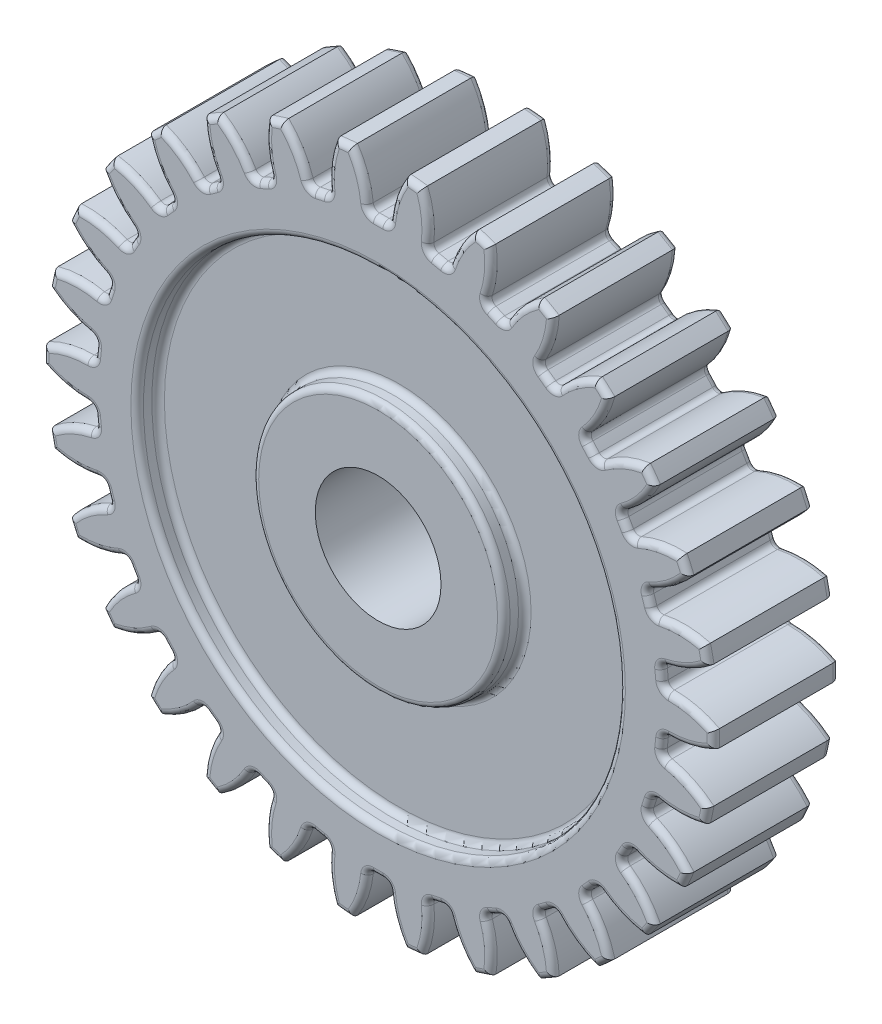
from build123d import *

# Parameters (mm, degrees)
SKBASE_R                                      = 16
BASE_DEPTH                                    = 7.5
TOOTHPROFILE_DEPTH                            = 24.837994882
FILLETTOOTHPROFILE_R                          = 0.3
CIRPATTERNTEETH_COUNT                         = 30
FILLETTOOTHPROFILE_OF_CIRPATTERNTEETH_R       = 0.3
SKCHAVETA_R                                   = 5
SKCHAVETA_W                                   = 3
SKCHAVETA_H                                   = 3
CHAVETA_DEPTH                                 = 28.117759464
SKREBAIXO_R                                   = 12.5
SKREBAIXO_R_2                                 = 7.5
REBAIXO_DEPTH                                 = 3
FILLETACABAMENTO_R                            = 0.2
BALANCEAMENTO_DEPTH                           = 26.580713003
CHAMFERBALANCEAMENTO_SIZE                     = 0.5
CHAMFERBALANCEAMENTO_OF_MIRRORBALANCEAME_SIZE = 0.5
BOSS_EXTRUDE1_DEPTH                           = 9
BOSS_EXTRUDE2_DEPTH                           = 15
SKETCH6_R                                     = 17.05207789
CUT_EXTRUDE1_DEPTH                            = 10
SKETCH7_R                                     = 17.444412972
CUT_EXTRUDE2_DEPTH                            = 10
SKETCH8_R                                     = 11.5
SKETCH8_R_2                                   = 6
CUT_EXTRUDE3_DEPTH                            = 1
FILLET1_R                                     = 0.3
FILLET2_R                                     = 0.3
SKETCH9_R                                     = 3
CUT_EXTRUDE4_DEPTH                            = 24.374620351


with BuildPart() as part:
    # skBase → Base (new, symmetric)
    with BuildSketch(Plane.XY):
        Circle(SKBASE_R)
    extrude(amount=BASE_DEPTH, both=True)

    # skToothProfile → ToothProfile (cut, symmetric)
    with BuildSketch(Plane.XY):
        with BuildLine():
            ThreePointArc((-0.512986858, 13.590321721), (-0.959792464, 15.394598198), (-2.08884202, 16.871180724))
            ThreePointArc((-2.08884202, 16.871180724), (0, 17), (2.08884202, 16.871180724))
            ThreePointArc((2.08884202, 16.871180724), (0.959792464, 15.394598198), (0.512986858, 13.590321721))
            ThreePointArc((0.512986858, 13.590321721), (0, 13.6), (-0.512986858, 13.590321721))
        make_face()
    toothprofile = extrude(amount=TOOTHPROFILE_DEPTH, both=True, mode=Mode.SUBTRACT)

    # FilletToothProfile
    fillettoothprofile_edges = [part.edges().sort_by_distance(p)[0] for p in [
        (-0.512986858, 13.590321721, 0),
        (0.512986858, 13.590321721, 0),
    ]]
    fillet(fillettoothprofile_edges, radius=FILLETTOOTHPROFILE_R)

    # CirPatternTeeth: ToothProfile ×30 about axis
    cirpatternteeth_axis = Axis((0, 0, 0), (0, 0, 1))
    for i in range(1, CIRPATTERNTEETH_COUNT):
        add(toothprofile.rotate(cirpatternteeth_axis, i * 360 / CIRPATTERNTEETH_COUNT), mode=Mode.SUBTRACT)

    # FilletToothProfile of CirPatternTeeth
    fillettoothprofile_of_cirpatternteeth_edges = [part.edges().sort_by_distance(p)[0] for p in [
        (-3.327363632, 13.18668462, 0),
        (-2.323809904, 13.39999655, 0),
        (-5.996318649, 12.206726124, 0),
        (-5.059045021, 12.624027229, 0),
        (-8.403205767, 10.693275122, 0),
        (-7.573175596, 11.296327341, 0),
        (-10.442832471, 8.712476685, 0),
        (-9.756322056, 9.474923743, 0),
        (-12.026057285, 6.35090121, 0),
        (-11.513070427, 7.239420511, 0),
        (-13.083685688, 3.711760877, 0),
        (-12.766642374, 4.687519865, 0),
        (-13.569494245, 0.910398783, 0),
        (-13.462250789, 1.930752107, 0),
        (-13.462250789, -1.930752107, 0),
        (-13.569494245, -0.910398783, 0),
        (-12.766642374, -4.687519865, 0),
        (-13.083685688, -3.711760877, 0),
        (-11.513070427, -7.239420511, 0),
        (-12.026057285, -6.35090121, 0),
        (-9.756322056, -9.474923743, 0),
        (-10.442832471, -8.712476685, 0),
        (-7.573175596, -11.296327341, 0),
        (-8.403205767, -10.693275122, 0),
        (-5.059045021, -12.624027229, 0),
        (-5.996318649, -12.206726124, 0),
        (-2.323809904, -13.39999655, 0),
        (-3.327363632, -13.18668462, 0),
        (0.512986858, -13.590321721, 0),
        (-0.512986858, -13.590321721, 0),
        (3.327363632, -13.18668462, 0),
        (2.323809904, -13.39999655, 0),
        (5.996318649, -12.206726124, 0),
        (5.059045021, -12.624027229, 0),
        (8.403205767, -10.693275122, 0),
        (7.573175596, -11.296327341, 0),
        (10.442832471, -8.712476685, 0),
        (9.756322056, -9.474923743, 0),
        (12.026057285, -6.35090121, 0),
        (11.513070427, -7.239420511, 0),
        (13.083685688, -3.711760877, 0),
        (12.766642374, -4.687519865, 0),
        (13.569494245, -0.910398783, 0),
        (13.462250789, -1.930752107, 0),
        (13.462250789, 1.930752107, 0),
        (13.569494245, 0.910398783, 0),
        (12.766642374, 4.687519865, 0),
        (13.083685688, 3.711760877, 0),
        (11.513070427, 7.239420511, 0),
        (12.026057285, 6.35090121, 0),
        (9.756322056, 9.474923743, 0),
        (10.442832471, 8.712476685, 0),
        (7.573175596, 11.296327341, 0),
        (8.403205767, 10.693275122, 0),
        (5.059045021, 12.624027229, 0),
        (5.996318649, 12.206726124, 0),
        (2.323809904, 13.39999655, 0),
        (3.327363632, 13.18668462, 0),
    ]]
    fillet(fillettoothprofile_of_cirpatternteeth_edges, radius=FILLETTOOTHPROFILE_OF_CIRPATTERNTEETH_R)

    # skChaveta → Chaveta (cut, through all)
    with BuildSketch(Plane.XY.offset(7.5)):
        Circle(SKCHAVETA_R)
        with Locations((0, 4.5)):
            Rectangle(SKCHAVETA_W, SKCHAVETA_H)
    extrude(amount=-CHAVETA_DEPTH, mode=Mode.SUBTRACT)

    # skRebaixo → Rebaixo (cut)
    with BuildSketch(Plane.XY.offset(7.5)):
        Circle(SKREBAIXO_R)
        Circle(SKREBAIXO_R_2, mode=Mode.SUBTRACT)
    rebaixo = extrude(amount=-REBAIXO_DEPTH, mode=Mode.SUBTRACT)

    # MirrorRebaixo: Rebaixo across plane
    add(rebaixo.mirror(Plane.XY), mode=Mode.SUBTRACT)

    # FilletAcabamento
    filletacabamento_edges = [part.edges().sort_by_distance(p)[0] for p in [
        (-15.650361612, 3.326587053, 7.5),
        (-16, 0, 7.5),
        (-15.650361612, -3.326587053, 7.5),
        (-14.616727322, -6.507786289, 7.5),
        (-12.94427191, -9.404564037, 7.5),
        (-10.706089702, -11.890317208, 7.5),
        (-8, -13.856406461, 7.5),
        (-0.776016127, 14.954425429, 7.5),
        (-4.94427191, -15.216904261, 7.5),
        (-1.672455412, -15.912350326, 7.5),
        (1.672455412, -15.912350326, 7.5),
        (4.94427191, -15.216904261, 7.5),
        (8, -13.856406461, 7.5),
        (10.706089702, -11.890317208, 7.5),
        (12.94427191, -9.404564037, 7.5),
        (14.616727322, -6.507786289, 7.5),
        (15.650361612, -3.326587053, 7.5),
        (16, 0, 7.5),
        (15.650361612, 3.326587053, 7.5),
        (14.616727322, 6.507786289, 7.5),
        (12.94427191, 9.404564037, 7.5),
        (10.706089702, 11.890317208, 7.5),
        (8, 13.856406461, 7.5),
        (4.94427191, 15.216904261, 7.5),
        (1.672455412, 15.912350326, 7.5),
        (14.791387749, 2.334928138, 7.5),
        (13.982701581, 5.359206793, 7.5),
        (12.562904257, 8.149262394, 7.5),
        (10.594047734, 10.583156124, 7.5),
        (8.162180489, 12.554515148, 7.5),
        (5.37358679, 13.977181617, 7.5),
        (2.350141564, 14.788978179, 7.5),
        (-3.868258189, 14.466292529, 7.5),
        (-6.791438806, 13.345913228, 7.5),
        (-9.417800958, 11.642253478, 7.5),
        (-11.632560017, 9.429771386, 7.5),
        (-13.338920384, 6.805163035, 7.5),
        (-14.462305923, 3.883136404, 7.5),
        (-14.953619295, 0.79139808, 7.5),
        (-14.791387749, -2.334928138, 7.5),
        (-13.982701581, -5.359206793, 7.5),
        (-12.562904257, -8.149262394, 7.5),
        (-10.594047734, -10.583156124, 7.5),
        (-8.162180489, -12.554515148, 7.5),
        (-5.37358679, -13.977181617, 7.5),
        (-2.350141564, -14.788978179, 7.5),
        (0.776016127, -14.954425429, 7.5),
        (3.868258189, -14.466292529, 7.5),
        (6.791438806, -13.345913228, 7.5),
        (9.417800958, -11.642253478, 7.5),
        (11.632560017, -9.429771386, 7.5),
        (13.338920384, -6.805163035, 7.5),
        (14.462305923, -3.883136404, 7.5),
        (14.953619295, -0.79139808, 7.5),
        (0.776016127, 14.954425429, -7.5),
        (0.776016127, 14.954425429, 7.5),
        (0, 13.6, -7.5),
        (0, 13.6, 7.5),
        (0.432989425, 13.674006708, 7.5),
        (0.432989425, 13.674006708, -7.5),
        (-0.432989425, 13.674006708, 7.5),
        (-0.432989425, 13.674006708, -7.5),
        (-4.94427191, 15.216904261, -7.5),
        (-8, 13.856406461, -7.5),
        (-10.706089702, 11.890317208, -7.5),
        (-12.94427191, 9.404564037, -7.5),
        (-14.616727322, 6.507786289, -7.5),
        (-15.650361612, 3.326587053, -7.5),
        (-16, 0, -7.5),
        (-15.650361612, -3.326587053, -7.5),
        (-14.616727322, -6.507786289, -7.5),
        (-12.94427191, -9.404564037, -7.5),
        (-10.706089702, -11.890317208, -7.5),
        (-8, -13.856406461, -7.5),
        (-4.94427191, -15.216904261, -7.5),
        (-1.672455412, -15.912350326, -7.5),
        (1.672455412, -15.912350326, -7.5),
        (4.94427191, -15.216904261, -7.5),
        (8, -13.856406461, -7.5),
        (10.706089702, -11.890317208, -7.5),
        (12.94427191, -9.404564037, -7.5),
        (14.616727322, -6.507786289, -7.5),
        (15.650361612, -3.326587053, -7.5),
        (-2.350141564, 14.788978179, -7.5),
        (-2.350141564, 14.788978179, 7.5),
        (-2.827598995, 13.30280737, -7.5),
        (-2.827598995, 13.30280737, 7.5),
        (16, 0, -7.5),
        (-2.419458288, 13.465220417, 7.5),
        (-2.419458288, 13.465220417, -7.5),
        (-3.266513422, 13.285173291, 7.5),
        (-3.266513422, 13.285173291, -7.5),
        (15.650361612, 3.326587053, -7.5),
        (-5.37358679, 13.977181617, -7.5),
        (14.616727322, 6.507786289, -7.5),
        (-5.37358679, 13.977181617, 7.5),
        (-5.531618346, 12.424218224, -7.5),
        (-5.531618346, 12.424218224, 7.5),
        (-5.166164064, 12.667939381, 7.5),
        (12.94427191, 9.404564037, -7.5),
        (-5.166164064, 12.667939381, -7.5),
        (-5.957275108, 12.315714051, 7.5),
        (-5.957275108, 12.315714051, -7.5),
        (10.706089702, 11.890317208, -7.5),
        (-8.162180489, 12.554515148, -7.5),
        (-8.162180489, 12.554515148, 7.5),
        (-7.993879431, 11.002631123, -7.5),
        (-7.993879431, 11.002631123, 7.5),
        (8, 13.856406461, -7.5),
        (-7.68708368, 11.317008606, 7.5),
        (-7.68708368, 11.317008606, -7.5),
        (-8.387675286, 10.80799901, 7.5),
        (-8.387675286, 10.80799901, -7.5),
        (4.94427191, 15.216904261, -7.5),
        (-10.594047734, 10.583156124, -7.5),
        (-10.594047734, 10.583156124, 7.5),
        (-10.106769626, 9.100176246, -7.5),
        (1.672455412, 15.912350326, -7.5),
        (-10.106769626, 9.100176246, 7.5),
        (-9.872040852, 9.47147025, 7.5),
        (-9.872040852, 9.47147025, -7.5),
        (-10.451493805, 8.82792255, 7.5),
        (-10.451493805, 8.82792255, -7.5),
        (2.350141564, 14.788978179, -7.5),
        (-12.562904257, 8.149262394, -7.5),
        (-12.562904257, 8.149262394, 7.5),
        (-11.777945491, 6.8, -7.5),
        (-11.777945491, 6.8, 7.5),
        (-11.625542468, 7.211983195, 7.5),
        (-11.625542468, 7.211983195, -7.5),
        (-12.058531893, 6.462023513, 7.5),
        (-12.058531893, 6.462023513, -7.5),
        (-1.672455412, 15.912350326, -7.5),
        (5.37358679, 13.977181617, -7.5),
        (-13.982701581, 5.359206793, -7.5),
        (-13.982701581, 5.359206793, 7.5),
        (-12.934368622, 4.202631123, -7.5),
        (-12.934368622, 4.202631123, 7.5),
        (-12.870952093, 4.637297868, 7.5),
        (-12.870952093, 4.637297868, -7.5),
        (-13.138554274, 3.81370304, 7.5),
        (-13.138554274, 3.81370304, -7.5),
        (8.162180489, 12.554515148, -7.5),
        (-14.791387749, 2.334928138, -7.5),
        (-14.791387749, 2.334928138, 7.5),
        (-13.525497777, 1.4215871, -7.5),
        (-13.525497777, 1.4215871, 7.5),
        (-13.55383935, 1.859940371, 7.5),
        (-13.55383935, 1.859940371, -7.5),
        (-13.644358788, 0.998705445, 7.5),
        (-13.644358788, 0.998705445, -7.5),
        (10.594047734, 10.583156124, -7.5),
        (-14.953619295, -0.79139808, -7.5),
        (-14.953619295, -0.79139808, 7.5),
        (-13.525497777, -1.4215871, -7.5),
        (-13.525497777, -1.4215871, 7.5),
        (-13.644358788, -0.998705445, 7.5),
        (-13.644358788, -0.998705445, -7.5),
        (-13.55383935, -1.859940371, 7.5),
        (-13.55383935, -1.859940371, -7.5),
        (12.562904257, 8.149262394, -7.5),
        (-14.462305923, -3.883136404, -7.5),
        (-14.462305923, -3.883136404, 7.5),
        (-12.934368622, -4.202631123, -7.5),
        (-12.934368622, -4.202631123, 7.5),
        (-13.138554274, -3.81370304, 7.5),
        (-13.138554274, -3.81370304, -7.5),
        (-12.870952093, -4.637297868, 7.5),
        (-12.870952093, -4.637297868, -7.5),
        (13.982701581, 5.359206793, -7.5),
        (-13.338920384, -6.805163035, -7.5),
        (-13.338920384, -6.805163035, 7.5),
        (-11.777945491, -6.8, -7.5),
        (-11.777945491, -6.8, 7.5),
        (-12.058531893, -6.462023513, 7.5),
        (-12.058531893, -6.462023513, -7.5),
        (-11.625542468, -7.211983195, 7.5),
        (-11.625542468, -7.211983195, -7.5),
        (14.791387749, 2.334928138, -7.5),
        (-11.632560017, -9.429771386, -7.5),
        (-11.632560017, -9.429771386, 7.5),
        (-10.106769626, -9.100176246, -7.5),
        (-10.106769626, -9.100176246, 7.5),
        (-10.451493805, -8.82792255, 7.5),
        (-10.451493805, -8.82792255, -7.5),
        (-9.872040852, -9.47147025, 7.5),
        (-9.872040852, -9.47147025, -7.5),
        (14.953619295, -0.79139808, -7.5),
        (-9.417800958, -11.642253478, -7.5),
        (-9.417800958, -11.642253478, 7.5),
        (-7.993879431, -11.002631123, -7.5),
        (-7.993879431, -11.002631123, 7.5),
        (-8.387675286, -10.80799901, 7.5),
        (-8.387675286, -10.80799901, -7.5),
        (-7.68708368, -11.317008606, 7.5),
        (-7.68708368, -11.317008606, -7.5),
        (-0.776016127, 14.954425429, -7.5),
        (14.462305923, -3.883136404, -7.5),
        (-6.791438806, -13.345913228, -7.5),
        (-6.791438806, -13.345913228, 7.5),
        (-5.531618346, -12.424218224, -7.5),
        (-5.531618346, -12.424218224, 7.5),
        (-5.957275108, -12.315714051, 7.5),
        (-5.957275108, -12.315714051, -7.5),
        (-5.166164064, -12.667939381, 7.5),
        (-5.166164064, -12.667939381, -7.5),
        (13.338920384, -6.805163035, -7.5),
        (-3.868258189, -14.466292529, -7.5),
        (-3.868258189, -14.466292529, 7.5),
        (-2.827598995, -13.30280737, -7.5),
        (-2.827598995, -13.30280737, 7.5),
        (-3.266513422, -13.285173291, 7.5),
        (-3.266513422, -13.285173291, -7.5),
        (-2.419458288, -13.465220417, 7.5),
        (-2.419458288, -13.465220417, -7.5),
        (11.632560017, -9.429771386, -7.5),
        (-0.776016127, -14.954425429, -7.5),
        (-0.776016127, -14.954425429, 7.5),
        (0, -13.6, -7.5),
        (0, -13.6, 7.5),
        (-0.432989425, -13.674006708, 7.5),
        (-0.432989425, -13.674006708, -7.5),
        (0.432989425, -13.674006708, 7.5),
        (0.432989425, -13.674006708, -7.5),
        (9.417800958, -11.642253478, -7.5),
        (2.350141564, -14.788978179, -7.5),
        (2.350141564, -14.788978179, 7.5),
        (2.827598995, -13.30280737, -7.5),
        (2.827598995, -13.30280737, 7.5),
        (2.419458288, -13.465220417, 7.5),
        (2.419458288, -13.465220417, -7.5),
        (3.266513422, -13.285173291, 7.5),
        (3.266513422, -13.285173291, -7.5),
        (6.791438806, -13.345913228, -7.5),
        (5.37358679, -13.977181617, -7.5),
        (5.37358679, -13.977181617, 7.5),
        (5.531618346, -12.424218224, -7.5),
        (5.531618346, -12.424218224, 7.5),
        (5.166164064, -12.667939381, 7.5),
        (5.166164064, -12.667939381, -7.5),
        (5.957275108, -12.315714051, 7.5),
        (5.957275108, -12.315714051, -7.5),
        (3.868258189, -14.466292529, -7.5),
        (8.162180489, -12.554515148, -7.5),
        (8.162180489, -12.554515148, 7.5),
        (7.993879431, -11.002631123, -7.5),
        (7.993879431, -11.002631123, 7.5),
        (7.68708368, -11.317008606, 7.5),
        (7.68708368, -11.317008606, -7.5),
        (8.387675286, -10.80799901, 7.5),
        (8.387675286, -10.80799901, -7.5),
        (0.776016127, -14.954425429, -7.5),
        (-1.672455412, 15.912350326, 7.5),
        (10.594047734, -10.583156124, -7.5),
        (10.594047734, -10.583156124, 7.5),
        (10.106769626, -9.100176246, -7.5),
        (10.106769626, -9.100176246, 7.5),
        (9.872040852, -9.47147025, 7.5),
        (9.872040852, -9.47147025, -7.5),
        (10.451493805, -8.82792255, 7.5),
        (10.451493805, -8.82792255, -7.5),
        (-2.350141564, -14.788978179, -7.5),
        (12.562904257, -8.149262394, -7.5),
        (12.562904257, -8.149262394, 7.5),
        (11.777945491, -6.8, -7.5),
        (11.777945491, -6.8, 7.5),
        (11.625542468, -7.211983195, 7.5),
        (11.625542468, -7.211983195, -7.5),
        (12.058531893, -6.462023513, 7.5),
        (12.058531893, -6.462023513, -7.5),
        (-5.37358679, -13.977181617, -7.5),
        (13.982701581, -5.359206793, -7.5),
        (13.982701581, -5.359206793, 7.5),
        (12.934368622, -4.202631123, -7.5),
        (12.934368622, -4.202631123, 7.5),
        (12.870952093, -4.637297868, 7.5),
        (12.870952093, -4.637297868, -7.5),
        (13.138554274, -3.81370304, 7.5),
        (13.138554274, -3.81370304, -7.5),
        (-8.162180489, -12.554515148, -7.5),
        (14.791387749, -2.334928138, -7.5),
        (14.791387749, -2.334928138, 7.5),
        (13.525497777, -1.4215871, -7.5),
        (13.525497777, -1.4215871, 7.5),
        (13.55383935, -1.859940371, 7.5),
        (13.55383935, -1.859940371, -7.5),
        (13.644358788, -0.998705445, 7.5),
        (13.644358788, -0.998705445, -7.5),
        (-10.594047734, -10.583156124, -7.5),
        (14.953619295, 0.79139808, -7.5),
        (14.953619295, 0.79139808, 7.5),
        (13.525497777, 1.4215871, -7.5),
        (13.525497777, 1.4215871, 7.5),
        (13.644358788, 0.998705445, 7.5),
        (13.644358788, 0.998705445, -7.5),
        (13.55383935, 1.859940371, 7.5),
        (13.55383935, 1.859940371, -7.5),
        (-12.562904257, -8.149262394, -7.5),
        (14.462305923, 3.883136404, -7.5),
        (14.462305923, 3.883136404, 7.5),
        (12.934368622, 4.202631123, -7.5),
        (12.934368622, 4.202631123, 7.5),
        (13.138554274, 3.81370304, 7.5),
        (13.138554274, 3.81370304, -7.5),
        (12.870952093, 4.637297868, 7.5),
        (12.870952093, 4.637297868, -7.5),
        (-13.982701581, -5.359206793, -7.5),
        (13.338920384, 6.805163035, -7.5),
        (13.338920384, 6.805163035, 7.5),
        (11.777945491, 6.8, -7.5),
        (11.777945491, 6.8, 7.5),
        (12.058531893, 6.462023513, 7.5),
        (12.058531893, 6.462023513, -7.5),
        (11.625542468, 7.211983195, 7.5),
        (11.625542468, 7.211983195, -7.5),
        (-14.791387749, -2.334928138, -7.5),
        (11.632560017, 9.429771386, -7.5),
        (11.632560017, 9.429771386, 7.5),
        (10.106769626, 9.100176246, -7.5),
        (10.106769626, 9.100176246, 7.5),
        (10.451493805, 8.82792255, 7.5),
        (10.451493805, 8.82792255, -7.5),
        (9.872040852, 9.47147025, 7.5),
        (9.872040852, 9.47147025, -7.5),
        (-14.953619295, 0.79139808, -7.5),
        (9.417800958, 11.642253478, -7.5),
        (9.417800958, 11.642253478, 7.5),
        (7.993879431, 11.002631123, -7.5),
        (7.993879431, 11.002631123, 7.5),
        (8.387675286, 10.80799901, 7.5),
        (8.387675286, 10.80799901, -7.5),
        (7.68708368, 11.317008606, 7.5),
        (-14.462305923, 3.883136404, -7.5),
        (7.68708368, 11.317008606, -7.5),
        (6.791438806, 13.345913228, -7.5),
        (6.791438806, 13.345913228, 7.5),
        (5.531618346, 12.424218224, -7.5),
        (5.531618346, 12.424218224, 7.5),
        (5.957275108, 12.315714051, 7.5),
        (5.957275108, 12.315714051, -7.5),
        (5.166164064, 12.667939381, 7.5),
        (-13.338920384, 6.805163035, -7.5),
        (5.166164064, 12.667939381, -7.5),
        (3.868258189, 14.466292529, -7.5),
        (3.868258189, 14.466292529, 7.5),
        (2.827598995, 13.30280737, -7.5),
        (2.827598995, 13.30280737, 7.5),
        (3.266513422, 13.285173291, 7.5),
        (3.266513422, 13.285173291, -7.5),
        (2.419458288, 13.465220417, 7.5),
        (-11.632560017, 9.429771386, -7.5),
        (2.419458288, 13.465220417, -7.5),
        (-9.417800958, 11.642253478, -7.5),
        (-6.791438806, 13.345913228, -7.5),
        (-1.5, 5.384848004, -7.5),
        (0, 6, 7.5),
        (-1.5, 6, 0),
        (1.5, 5.384848004, 7.5),
        (1.5, 4.769696007, 0),
        (1.5, 6, 0),
        (-1.5, 5.384848004, 7.5),
        (0, -5, 7.5),
        (1.5, 5.384848004, -7.5),
        (0, 6, -7.5),
        (-1.5, 4.769696007, 0),
        (0, -5, -7.5),
        (-12.5, 0, 4.5),
        (-7.5, 0, 4.5),
        (-3.868258189, 14.466292529, -7.5),
        (-12.5, 0, 7.5),
        (-7.5, 0, 7.5),
        (-12.5, 0, -4.5),
        (-7.5, 0, -7.5),
        (-12.5, 0, -7.5),
        (-7.5, 0, -4.5),
        (-4.94427191, 15.216904261, 7.5),
        (-8, 13.856406461, 7.5),
        (-10.706089702, 11.890317208, 7.5),
        (-12.94427191, 9.404564037, 7.5),
        (-14.616727322, 6.507786289, 7.5),
    ]]
    fillet(filletacabamento_edges, radius=FILLETACABAMENTO_R)

    # skBalanceamento → Balanceamento (cut, through all)
    with BuildSketch(Plane(origin=(0, 0, -4.5), x_dir=(-1, 0, 0), z_dir=(0, 0, -1))):
        with BuildLine():
            ThreePointArc((9.526279442, 5.5), (0, 11), (-9.526279442, 5.5))
            ThreePointArc((-9.526279442, 5.5), (-9.160254038, 4.133974596), (-7.794228634, 4.5))
            ThreePointArc((-7.794228634, 4.5), (0, 9), (7.794228634, 4.5))
            ThreePointArc((7.794228634, 4.5), (9.160254038, 4.133974596), (9.526279442, 5.5))
        make_face()
    balanceamento = extrude(amount=-BALANCEAMENTO_DEPTH, mode=Mode.SUBTRACT)

    # ChamferBalanceamento
    chamferbalanceamento_edges = [part.edges().sort_by_distance(p)[0] for p in [
        (-9.160254038, 4.133974596, 4.5),
        (0, 9, 4.5),
        (9.160254038, 4.133974596, 4.5),
        (0, 11, 4.5),
        (-9.160254038, 4.133974596, -4.5),
        (0, 11, -4.5),
        (9.160254038, 4.133974596, -4.5),
        (0, 9, -4.5),
    ]]
    chamfer(chamferbalanceamento_edges, length=CHAMFERBALANCEAMENTO_SIZE)

    # MirrorBalanceamento: Balanceamento across plane
    add(balanceamento.mirror(Plane.ZX), mode=Mode.SUBTRACT)

    # ChamferBalanceamento of MirrorBalanceame
    chamferbalanceamento_of_mirrorbalanceame_edges = [part.edges().sort_by_distance(p)[0] for p in [
        (-9.160254038, -4.133974596, 4.5),
        (0, -9, 4.5),
        (9.160254038, -4.133974596, 4.5),
        (0, -11, 4.5),
        (-9.160254038, -4.133974596, -4.5),
        (0, -11, -4.5),
        (9.160254038, -4.133974596, -4.5),
        (0, -9, -4.5),
    ]]
    chamfer(chamferbalanceamento_of_mirrorbalanceame_edges, length=CHAMFERBALANCEAMENTO_OF_MIRRORBALANCEAME_SIZE)

    # Sketch4 → Boss-Extrude1 (add)
    with BuildSketch(Plane(origin=(0, 0, -4.5), x_dir=(-1, 0, 0), z_dir=(0, 0, -1))):
        with BuildLine():
            ThreePointArc((9.959292144, 5.75), (0, 11.5), (-9.959292144, 5.75))
            ThreePointArc((-9.959292144, 5.75), (-9.410254038, 3.700961894), (-7.361215932, 4.25))
            ThreePointArc((-7.361215932, 4.25), (0, 8.5), (7.361215932, 4.25))
            ThreePointArc((7.361215932, 4.25), (9.410254038, 3.700961894), (9.959292144, 5.75))
        make_face()
        with BuildLine():
            ThreePointArc((9.959292144, -5.75), (9.410254038, -3.700961894), (7.361215932, -4.25))
            ThreePointArc((7.361215932, -4.25), (0, -8.5), (-7.361215932, -4.25))
            ThreePointArc((-7.361215932, -4.25), (-9.410254038, -3.700961894), (-9.959292144, -5.75))
            ThreePointArc((-9.959292144, -5.75), (0, -11.5), (9.959292144, -5.75))
        make_face()
    extrude(amount=-BOSS_EXTRUDE1_DEPTH)

    # Sketch5 → Boss-Extrude2 (add)
    with BuildSketch(Plane(origin=(0, 0, -7.5), x_dir=(-1, 0, 0), z_dir=(0, 0, -1))):
        with BuildLine():
            Line((1.7, 5.8), (1.7, 4.91426495))
            ThreePointArc((1.7, 4.91426495), (0, -5.2), (-1.7, 4.91426495))
            Line((-1.7, 4.91426495), (-1.7, 5.8))
            ThreePointArc((-1.7, 5.8), (-1.582842712, 6.082842712), (-1.3, 6.2))
            Line((-1.3, 6.2), (1.3, 6.2))
            ThreePointArc((1.3, 6.2), (1.582842712, 6.082842712), (1.7, 5.8))
        make_face()
        with BuildLine():
            Line((-2, 1.5), (2, 1.5))
            ThreePointArc((2, 1.5), (2.5, 0), (2, -1.5))
            Line((2, -1.5), (-2, -1.5))
            ThreePointArc((-2, -1.5), (-2.5, 0), (-2, 1.5))
        make_face(mode=Mode.SUBTRACT)
    extrude(amount=-BOSS_EXTRUDE2_DEPTH)

    # Sketch6 → Cut-Extrude1 (cut)
    with BuildSketch(Plane.XY.offset(3)):
        Circle(SKETCH6_R)
    extrude(amount=CUT_EXTRUDE1_DEPTH, mode=Mode.SUBTRACT)

    # Sketch7 → Cut-Extrude2 (cut)
    with BuildSketch(Plane.XY.offset(-3)):
        Circle(SKETCH7_R)
    extrude(amount=-CUT_EXTRUDE2_DEPTH, mode=Mode.SUBTRACT)

    # Sketch8 → Cut-Extrude3 (cut)
    with BuildSketch(Plane(origin=(0, 0, -3), x_dir=(-1, 0, 0), z_dir=(0, 0, -1))):
        Circle(SKETCH8_R)
        Circle(SKETCH8_R_2, mode=Mode.SUBTRACT)
    cut_extrude3 = extrude(amount=-CUT_EXTRUDE3_DEPTH, mode=Mode.SUBTRACT)

    # Mirror1: Cut-Extrude3 across plane
    add(cut_extrude3.mirror(Plane.XY), mode=Mode.SUBTRACT)

    # Fillet1
    fillet1_edges = [part.edges().sort_by_distance(p)[0] for p in [
        (11.5, 0, -2),
        (6, 0, -2),
        (11.5, 0, -3),
        (6, 0, -3),
        (11.5, 0, 2),
        (6, 0, 3),
        (11.5, 0, 3),
        (6, 0, 2),
    ]]
    fillet(fillet1_edges, radius=FILLET1_R)

    # Fillet2
    fillet2_edges = [part.edges().sort_by_distance(p)[0] for p in [
        (-2.827598995, -13.30280737, 3),
        (-2.419458288, -13.465220417, 3),
        (-2.350141564, -14.788978179, 3),
        (-1.672455412, -15.912350326, 3),
        (-0.776016127, -14.954425429, 3),
        (-0.432989425, -13.674006708, 3),
        (0, -13.6, 3),
        (0.432989425, -13.674006708, 3),
        (0.776016127, -14.954425429, 3),
        (1.672455412, -15.912350326, 3),
        (2.350141564, -14.788978179, 3),
        (2.419458288, -13.465220417, 3),
        (2.827598995, -13.30280737, 3),
        (3.266513422, -13.285173291, 3),
        (3.868258189, -14.466292529, 3),
        (4.94427191, -15.216904261, 3),
        (5.37358679, -13.977181617, 3),
        (5.166164064, -12.667939381, 3),
        (5.531618346, -12.424218224, 3),
        (5.957275108, -12.315714051, 3),
        (6.791438806, -13.345913228, 3),
        (8, -13.856406461, 3),
        (8.162180489, -12.554515148, 3),
        (7.68708368, -11.317008606, 3),
        (7.993879431, -11.002631123, 3),
        (8.387675286, -10.80799901, 3),
        (9.417800958, -11.642253478, 3),
        (10.706089702, -11.890317208, 3),
        (10.594047734, -10.583156124, 3),
        (9.872040852, -9.47147025, 3),
        (10.106769626, -9.100176246, 3),
        (10.451493805, -8.82792255, 3),
        (11.632560017, -9.429771386, 3),
        (12.94427191, -9.404564037, 3),
        (12.562904257, -8.149262394, 3),
        (11.625542468, -7.211983195, 3),
        (11.777945491, -6.8, 3),
        (12.058531893, -6.462023513, 3),
        (13.338920384, -6.805163035, 3),
        (14.616727322, -6.507786289, 3),
        (13.982701581, -5.359206793, 3),
        (12.870952093, -4.637297868, 3),
        (12.934368622, -4.202631123, 3),
        (13.138554274, -3.81370304, 3),
        (14.462305923, -3.883136404, 3),
        (15.650361612, -3.326587053, 3),
        (14.791387749, -2.334928138, 3),
        (13.55383935, -1.859940371, 3),
        (13.525497777, -1.4215871, 3),
        (13.644358788, -0.998705445, 3),
        (14.953619295, -0.79139808, 3),
        (16, 0, 3),
        (14.953619295, 0.79139808, 3),
        (13.644358788, 0.998705445, 3),
        (13.525497777, 1.4215871, 3),
        (13.55383935, 1.859940371, 3),
        (14.791387749, 2.334928138, 3),
        (15.650361612, 3.326587053, 3),
        (14.462305923, 3.883136404, 3),
        (13.138554274, 3.81370304, 3),
        (12.934368622, 4.202631123, 3),
        (12.870952093, 4.637297868, 3),
        (13.982701581, 5.359206793, 3),
        (14.616727322, 6.507786289, 3),
        (13.338920384, 6.805163035, 3),
        (12.058531893, 6.462023513, 3),
        (11.777945491, 6.8, 3),
        (11.625542468, 7.211983195, 3),
        (12.562904257, 8.149262394, 3),
        (12.94427191, 9.404564037, 3),
        (11.632560017, 9.429771386, 3),
        (10.451493805, 8.82792255, 3),
        (10.106769626, 9.100176246, 3),
        (9.872040852, 9.47147025, 3),
        (10.594047734, 10.583156124, 3),
        (10.706089702, 11.890317208, 3),
        (9.417800958, 11.642253478, 3),
        (8.387675286, 10.80799901, 3),
        (7.993879431, 11.002631123, 3),
        (7.68708368, 11.317008606, 3),
        (8.162180489, 12.554515148, 3),
        (8, 13.856406461, 3),
        (6.791438806, 13.345913228, 3),
        (5.957275108, 12.315714051, 3),
        (5.531618346, 12.424218224, 3),
        (5.166164064, 12.667939381, 3),
        (5.37358679, 13.977181617, 3),
        (4.94427191, 15.216904261, 3),
        (3.868258189, 14.466292529, 3),
        (3.266513422, 13.285173291, 3),
        (2.827598995, 13.30280737, 3),
        (2.419458288, 13.465220417, 3),
        (2.350141564, 14.788978179, 3),
        (1.672455412, 15.912350326, 3),
        (0.776016127, 14.954425429, 3),
        (0.432989425, 13.674006708, 3),
        (0, 13.6, 3),
        (-0.432989425, 13.674006708, 3),
        (-0.776016127, 14.954425429, 3),
        (-1.672455412, 15.912350326, 3),
        (-2.350141564, 14.788978179, 3),
        (-2.419458288, 13.465220417, 3),
        (-2.827598995, 13.30280737, 3),
        (-3.266513422, 13.285173291, 3),
        (-3.868258189, 14.466292529, 3),
        (-4.94427191, 15.216904261, 3),
        (-5.37358679, 13.977181617, 3),
        (-5.166164064, 12.667939381, 3),
        (-5.531618346, 12.424218224, 3),
        (-5.957275108, 12.315714051, 3),
        (-6.791438806, 13.345913228, 3),
        (-8, 13.856406461, 3),
        (-8.162180489, 12.554515148, 3),
        (-7.68708368, 11.317008606, 3),
        (-7.993879431, 11.002631123, 3),
        (-8.387675286, 10.80799901, 3),
        (-9.417800958, 11.642253478, 3),
        (-10.706089702, 11.890317208, 3),
        (-10.594047734, 10.583156124, 3),
        (-9.872040852, 9.47147025, 3),
        (-10.106769626, 9.100176246, 3),
        (-10.451493805, 8.82792255, 3),
        (-11.632560017, 9.429771386, 3),
        (-12.94427191, 9.404564037, 3),
        (-12.562904257, 8.149262394, 3),
        (-11.625542468, 7.211983195, 3),
        (-11.777945491, 6.8, 3),
        (-12.058531893, 6.462023513, 3),
        (-13.338920384, 6.805163035, 3),
        (-14.616727322, 6.507786289, 3),
        (-13.982701581, 5.359206793, 3),
        (-12.870952093, 4.637297868, 3),
        (-12.934368622, 4.202631123, 3),
        (-13.138554274, 3.81370304, 3),
        (-14.462305923, 3.883136404, 3),
        (-15.650361612, 3.326587053, 3),
        (-14.791387749, 2.334928138, 3),
        (-13.55383935, 1.859940371, 3),
        (-13.525497777, 1.4215871, 3),
        (-13.644358788, 0.998705445, 3),
        (-14.953619295, 0.79139808, 3),
        (-16, 0, 3),
        (-14.953619295, -0.79139808, 3),
        (-13.644358788, -0.998705445, 3),
        (-13.525497777, -1.4215871, 3),
        (-13.55383935, -1.859940371, 3),
        (-14.791387749, -2.334928138, 3),
        (-15.650361612, -3.326587053, 3),
        (-14.462305923, -3.883136404, 3),
        (-13.138554274, -3.81370304, 3),
        (-12.934368622, -4.202631123, 3),
        (-12.870952093, -4.637297868, 3),
        (-13.982701581, -5.359206793, 3),
        (-14.616727322, -6.507786289, 3),
        (-13.338920384, -6.805163035, 3),
        (-12.058531893, -6.462023513, 3),
        (-11.777945491, -6.8, 3),
        (-11.625542468, -7.211983195, 3),
        (-12.562904257, -8.149262394, 3),
        (-12.94427191, -9.404564037, 3),
        (-11.632560017, -9.429771386, 3),
        (-10.451493805, -8.82792255, 3),
        (-10.106769626, -9.100176246, 3),
        (-9.872040852, -9.47147025, 3),
        (-10.594047734, -10.583156124, 3),
        (-10.706089702, -11.890317208, 3),
        (-9.417800958, -11.642253478, 3),
        (-8.387675286, -10.80799901, 3),
        (-7.993879431, -11.002631123, 3),
        (-7.68708368, -11.317008606, 3),
        (-8.162180489, -12.554515148, 3),
        (-8, -13.856406461, 3),
        (-6.791438806, -13.345913228, 3),
        (-5.957275108, -12.315714051, 3),
        (-5.531618346, -12.424218224, 3),
        (-5.166164064, -12.667939381, 3),
        (-5.37358679, -13.977181617, 3),
        (-4.94427191, -15.216904261, 3),
        (-3.868258189, -14.466292529, 3),
        (-3.266513422, -13.285173291, 3),
        (-2.827598995, -13.30280737, -3),
        (-2.419458288, -13.465220417, -3),
        (-2.350141564, -14.788978179, -3),
        (-1.672455412, -15.912350326, -3),
        (-0.776016127, -14.954425429, -3),
        (-0.432989425, -13.674006708, -3),
        (0, -13.6, -3),
        (0.432989425, -13.674006708, -3),
        (0.776016127, -14.954425429, -3),
        (1.672455412, -15.912350326, -3),
        (2.350141564, -14.788978179, -3),
        (2.419458288, -13.465220417, -3),
        (2.827598995, -13.30280737, -3),
        (3.266513422, -13.285173291, -3),
        (3.868258189, -14.466292529, -3),
        (4.94427191, -15.216904261, -3),
        (5.37358679, -13.977181617, -3),
        (5.166164064, -12.667939381, -3),
        (5.531618346, -12.424218224, -3),
        (5.957275108, -12.315714051, -3),
        (6.791438806, -13.345913228, -3),
        (8, -13.856406461, -3),
        (8.162180489, -12.554515148, -3),
        (7.68708368, -11.317008606, -3),
        (7.993879431, -11.002631123, -3),
        (8.387675286, -10.80799901, -3),
        (9.417800958, -11.642253478, -3),
        (10.706089702, -11.890317208, -3),
        (10.594047734, -10.583156124, -3),
        (9.872040852, -9.47147025, -3),
        (10.106769626, -9.100176246, -3),
        (10.451493805, -8.82792255, -3),
        (11.632560017, -9.429771386, -3),
        (12.94427191, -9.404564037, -3),
        (12.562904257, -8.149262394, -3),
        (11.625542468, -7.211983195, -3),
        (11.777945491, -6.8, -3),
        (12.058531893, -6.462023513, -3),
        (13.338920384, -6.805163035, -3),
        (14.616727322, -6.507786289, -3),
        (13.982701581, -5.359206793, -3),
        (12.870952093, -4.637297868, -3),
        (12.934368622, -4.202631123, -3),
        (13.138554274, -3.81370304, -3),
        (14.462305923, -3.883136404, -3),
        (15.650361612, -3.326587053, -3),
        (14.791387749, -2.334928138, -3),
        (13.55383935, -1.859940371, -3),
        (13.525497777, -1.4215871, -3),
        (13.644358788, -0.998705445, -3),
        (14.953619295, -0.79139808, -3),
        (16, 0, -3),
        (14.953619295, 0.79139808, -3),
        (13.644358788, 0.998705445, -3),
        (13.525497777, 1.4215871, -3),
        (13.55383935, 1.859940371, -3),
        (14.791387749, 2.334928138, -3),
        (15.650361612, 3.326587053, -3),
        (14.462305923, 3.883136404, -3),
        (13.138554274, 3.81370304, -3),
        (12.934368622, 4.202631123, -3),
        (12.870952093, 4.637297868, -3),
        (13.982701581, 5.359206793, -3),
        (14.616727322, 6.507786289, -3),
        (13.338920384, 6.805163035, -3),
        (12.058531893, 6.462023513, -3),
        (11.777945491, 6.8, -3),
        (11.625542468, 7.211983195, -3),
        (12.562904257, 8.149262394, -3),
        (12.94427191, 9.404564037, -3),
        (11.632560017, 9.429771386, -3),
        (10.451493805, 8.82792255, -3),
        (10.106769626, 9.100176246, -3),
        (9.872040852, 9.47147025, -3),
        (10.594047734, 10.583156124, -3),
        (10.706089702, 11.890317208, -3),
        (9.417800958, 11.642253478, -3),
        (8.387675286, 10.80799901, -3),
        (7.993879431, 11.002631123, -3),
        (7.68708368, 11.317008606, -3),
        (8.162180489, 12.554515148, -3),
        (8, 13.856406461, -3),
        (6.791438806, 13.345913228, -3),
        (5.957275108, 12.315714051, -3),
        (5.531618346, 12.424218224, -3),
        (5.166164064, 12.667939381, -3),
        (5.37358679, 13.977181617, -3),
        (4.94427191, 15.216904261, -3),
        (3.868258189, 14.466292529, -3),
        (3.266513422, 13.285173291, -3),
        (2.827598995, 13.30280737, -3),
        (2.419458288, 13.465220417, -3),
        (2.350141564, 14.788978179, -3),
        (1.672455412, 15.912350326, -3),
        (0.776016127, 14.954425429, -3),
        (0.432989425, 13.674006708, -3),
        (0, 13.6, -3),
        (-0.432989425, 13.674006708, -3),
        (-0.776016127, 14.954425429, -3),
        (-1.672455412, 15.912350326, -3),
        (-2.350141564, 14.788978179, -3),
        (-2.419458288, 13.465220417, -3),
        (-2.827598995, 13.30280737, -3),
        (-3.266513422, 13.285173291, -3),
        (-3.868258189, 14.466292529, -3),
        (-4.94427191, 15.216904261, -3),
        (-5.37358679, 13.977181617, -3),
        (-5.166164064, 12.667939381, -3),
        (-5.531618346, 12.424218224, -3),
        (-5.957275108, 12.315714051, -3),
        (-6.791438806, 13.345913228, -3),
        (-8, 13.856406461, -3),
        (-8.162180489, 12.554515148, -3),
        (-7.68708368, 11.317008606, -3),
        (-7.993879431, 11.002631123, -3),
        (-8.387675286, 10.80799901, -3),
        (-9.417800958, 11.642253478, -3),
        (-10.706089702, 11.890317208, -3),
        (-10.594047734, 10.583156124, -3),
        (-9.872040852, 9.47147025, -3),
        (-10.106769626, 9.100176246, -3),
        (-10.451493805, 8.82792255, -3),
        (-11.632560017, 9.429771386, -3),
        (-12.94427191, 9.404564037, -3),
        (-12.562904257, 8.149262394, -3),
        (-11.625542468, 7.211983195, -3),
        (-11.777945491, 6.8, -3),
        (-12.058531893, 6.462023513, -3),
        (-13.338920384, 6.805163035, -3),
        (-14.616727322, 6.507786289, -3),
        (-13.982701581, 5.359206793, -3),
        (-12.870952093, 4.637297868, -3),
        (-12.934368622, 4.202631123, -3),
        (-13.138554274, 3.81370304, -3),
        (-14.462305923, 3.883136404, -3),
        (-15.650361612, 3.326587053, -3),
        (-14.791387749, 2.334928138, -3),
        (-13.55383935, 1.859940371, -3),
        (-13.525497777, 1.4215871, -3),
        (-13.644358788, 0.998705445, -3),
        (-14.953619295, 0.79139808, -3),
        (-16, 0, -3),
        (-14.953619295, -0.79139808, -3),
        (-13.644358788, -0.998705445, -3),
        (-13.525497777, -1.4215871, -3),
        (-13.55383935, -1.859940371, -3),
        (-14.791387749, -2.334928138, -3),
        (-15.650361612, -3.326587053, -3),
        (-14.462305923, -3.883136404, -3),
        (-13.138554274, -3.81370304, -3),
        (-12.934368622, -4.202631123, -3),
        (-12.870952093, -4.637297868, -3),
        (-13.982701581, -5.359206793, -3),
        (-14.616727322, -6.507786289, -3),
        (-13.338920384, -6.805163035, -3),
        (-12.058531893, -6.462023513, -3),
        (-11.777945491, -6.8, -3),
        (-11.625542468, -7.211983195, -3),
        (-12.562904257, -8.149262394, -3),
        (-12.94427191, -9.404564037, -3),
        (-11.632560017, -9.429771386, -3),
        (-10.451493805, -8.82792255, -3),
        (-10.106769626, -9.100176246, -3),
        (-9.872040852, -9.47147025, -3),
        (-10.594047734, -10.583156124, -3),
        (-10.706089702, -11.890317208, -3),
        (-9.417800958, -11.642253478, -3),
        (-8.387675286, -10.80799901, -3),
        (-7.993879431, -11.002631123, -3),
        (-7.68708368, -11.317008606, -3),
        (-8.162180489, -12.554515148, -3),
        (-8, -13.856406461, -3),
        (-6.791438806, -13.345913228, -3),
        (-5.957275108, -12.315714051, -3),
        (-5.531618346, -12.424218224, -3),
        (-5.166164064, -12.667939381, -3),
        (-5.37358679, -13.977181617, -3),
        (-4.94427191, -15.216904261, -3),
        (-3.868258189, -14.466292529, -3),
        (-3.266513422, -13.285173291, -3),
    ]]
    fillet(fillet2_edges, radius=FILLET2_R)

    # Sketch9 → Cut-Extrude4 (cut, through all)
    with BuildSketch(Plane.XY.offset(3)):
        Circle(SKETCH9_R)
    extrude(amount=-CUT_EXTRUDE4_DEPTH, mode=Mode.SUBTRACT)


solid = part.part
